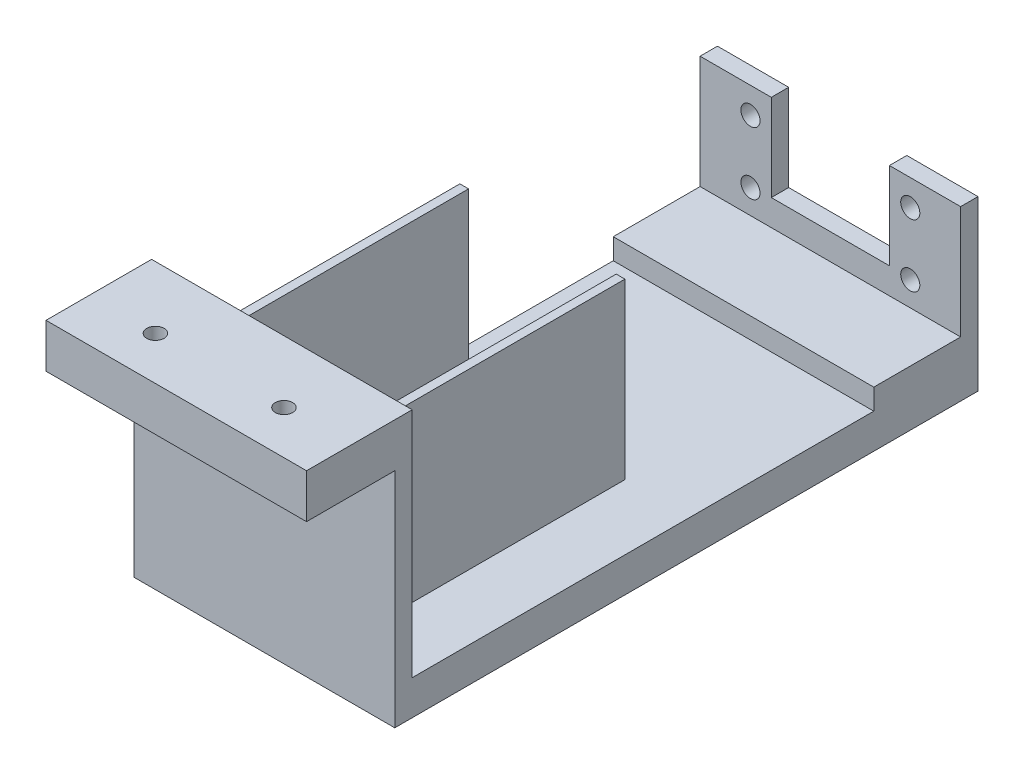
from build123d import *

# Parameters (mm, degrees)
SKETCH1_R                = 2.75
BOSS_EXTRUDE1_DEPTH      = 5
BOSS_EXTRUDE2_DEPTH      = 25
BOSS_EXTRUDE2_DEPTH_BACK = 5
SKETCH2_W                = 75
SKETCH2_H                = 6
SKETCH3_W                = 75
SKETCH3_H                = 10
BOSS_EXTRUDE3_DEPTH      = 167.8942
SKETCH4_W                = 75
SKETCH4_H                = 5
BOSS_EXTRUDE4_DEPTH      = 66.8
SKETCH5_W                = 75
SKETCH5_H                = 12.7
BOSS_EXTRUDE5_DEPTH      = 25.4
SKETCH8_W                = 2.5
SKETCH8_H                = 50
BOSS_EXTRUDE6_DEPTH      = 75
SKETCH9_R                = 2.5
CUT_EXTRUDE1_DEPTH       = 222.10153268


with BuildPart() as part:
    # Sketch1 → Boss-Extrude1 (new body)
    with BuildSketch(Plane.XY):
        Polygon((20.5, 7.5), (20.5, 32.5), (0, 32.5), (0, 0), (75, 0), (75, 32.5), (54.5, 32.5), (54.5, 7.5), align=None)
        with Locations((14.5, 7)):
            Circle(SKETCH1_R, mode=Mode.SUBTRACT)
        with Locations((14.5, 25)):
            Circle(SKETCH1_R, mode=Mode.SUBTRACT)
        with Locations((60.5, 25)):
            Circle(SKETCH1_R, mode=Mode.SUBTRACT)
        with Locations((60.5, 7)):
            Circle(SKETCH1_R, mode=Mode.SUBTRACT)
    extrude(amount=BOSS_EXTRUDE1_DEPTH)

    # Sketch2 → Boss-Extrude2 (add, two sides: drawn at the far end of the back side and taken through both)
    with BuildSketch(Plane.XY.offset(5).offset(-BOSS_EXTRUDE2_DEPTH_BACK)):
        with Locations((37.5, -3)):
            Rectangle(SKETCH2_W, SKETCH2_H)
    extrude(amount=BOSS_EXTRUDE2_DEPTH + BOSS_EXTRUDE2_DEPTH_BACK)

    # Sketch3 → Boss-Extrude3 (add)
    with BuildSketch(Plane(origin=(0, 0, 0), x_dir=(-1, 0, 0), z_dir=(0, 0, -1))):
        with Locations((-37.5, -11)):
            Rectangle(SKETCH3_W, SKETCH3_H)
    extrude(amount=-BOSS_EXTRUDE3_DEPTH)

    # Sketch4 → Boss-Extrude4 (add)
    with BuildSketch(Plane(origin=(0, -6, 0), x_dir=(1, 0, 0), z_dir=(0, 1, 0))):
        with Locations((37.5, -165.3942)):
            Rectangle(SKETCH4_W, SKETCH4_H)
    extrude(amount=BOSS_EXTRUDE4_DEPTH)

    # Sketch5 → Boss-Extrude5 (add)
    with BuildSketch(Plane.XY.offset(167.8942)):
        with Locations((37.5, 54.45)):
            Rectangle(SKETCH5_W, SKETCH5_H)
    extrude(amount=BOSS_EXTRUDE5_DEPTH)

    # Sketch8 → Boss-Extrude6 (add)
    with BuildSketch(Plane(origin=(0, 0, 162.8942), x_dir=(-1, 0, 0), z_dir=(0, 0, -1))):
        with Locations((-60, 24)):
            Rectangle(SKETCH8_W, SKETCH8_H)
        with Locations((-15, 24)):
            Rectangle(SKETCH8_W, SKETCH8_H)
    extrude(amount=BOSS_EXTRUDE6_DEPTH)

    # Sketch9 → Cut-Extrude1 (cut, through all)
    with BuildSketch(Plane(origin=(0, 60.8, 0), x_dir=(1, 0, 0), z_dir=(0, 1, 0))):
        with Locations((56, -180.7942)):
            Circle(SKETCH9_R)
        with Locations((19, -180.7942)):
            Circle(SKETCH9_R)
    extrude(amount=-CUT_EXTRUDE1_DEPTH, mode=Mode.SUBTRACT)


solid = part.part
